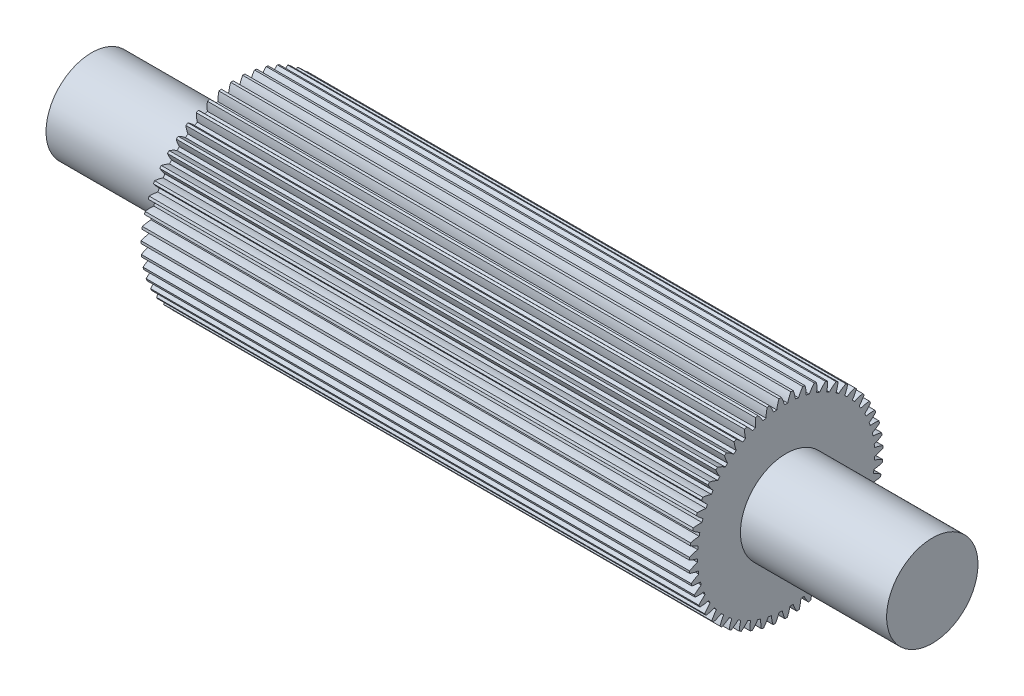
from build123d import *

# Parameters (mm, degrees)
BASPROSKE_W     = 80
BASPROSKE_H     = 53
TOOTHCUT_DEPTH  = 110.626639098
TEETHCUTS_COUNT = 51
TEETHCUTS_ANGLE = 352.941176471
BORSKE_R        = 0.4
BORE_DEPTH      = 80.0000508
SKETCH_2_R      = 25
EXTRUDE_1_DEPTH = 100
EXTRUDE_START   = -180
SKETCH_2_2_R    = 25
EXTRUDE_2_DEPTH = 100
EXTRUDE_3_DEPTH = 110
EXTRUDE_4_DEPTH = 110
SKETCH_5_R      = 25
EXTRUDE_5_DEPTH = 80
EXTRUDE_START_2 = -380
SKETCH_5_2_R    = 25
EXTRUDE_6_DEPTH = 80


with BuildPart() as part:
    # BasProSke → Base-Revolve (revolve)
    with BuildSketch(Plane(origin=(0, 0, 0), x_dir=(1, 0, 0), z_dir=(0, 1, 0)), mode=Mode.PRIVATE) as base_revolve_sk:
        with Locations((40, 26.5)):
            Rectangle(BASPROSKE_W, BASPROSKE_H)
    revolve(base_revolve_sk.sketch.rotate(Axis((-10, 0, 0), (1, 0, 0)), 180), axis=Axis((-10, 0, 0), (1, 0, 0)))

    # TooCutSke → ToothCut (cut, through all)
    with BuildSketch(Plane(origin=(0, 0, 0), x_dir=(0, 0, -1), z_dir=(1, 0, 0))):
        with BuildLine():
            ThreePointArc((0.858856185, 48.491394773), (0, 48.499), (-0.858856185, 48.491394773))
            ThreePointArc((-0.858856185, 48.491394773), (-1.609966515, 50.778076129), (-2.625171834, 52.960376868))
            ThreePointArc((-2.625171834, 52.960376868), (0, 53.0254), (2.625171834, 52.960376868))
            ThreePointArc((2.625171834, 52.960376868), (1.609966515, 50.778076129), (0.858856185, 48.491394773))
        make_face()
    toothcut = extrude(amount=TOOTHCUT_DEPTH, mode=Mode.SUBTRACT)

    # TeethCuts: ToothCut ×51 about axis
    teethcuts_axis = Axis((-10, 0, 0), (1, 0, 0))
    for i in range(1, TEETHCUTS_COUNT):
        add(toothcut.rotate(teethcuts_axis, i * TEETHCUTS_ANGLE / (TEETHCUTS_COUNT - 1)), mode=Mode.SUBTRACT)

    # BorSke → Bore (cut, symmetric)
    with BuildSketch(Plane(origin=(0, 0, 0), x_dir=(0, 0, -1), z_dir=(1, 0, 0))):
        with Locations(Location((0, 0, 0), (0, 0, 180))):
            Circle(BORSKE_R)
    extrude(amount=BORE_DEPTH, both=True, mode=Mode.SUBTRACT)

    # 草圖2 → 填料-伸長1 (add)
    with BuildSketch(Plane(origin=(80, 0, 0), x_dir=(0, 0, -1), z_dir=(1, 0, 0))):
        with Locations(Location((0.4, 0, 0), (0, 0, 180))):
            Circle(SKETCH_2_R)
    extrude(amount=EXTRUDE_1_DEPTH)

    # 草圖2<2> → 填料-伸長2 (add)
    with BuildSketch(Plane(origin=(80, 0, 0), x_dir=(0, 0, -1), z_dir=(1, 0, 0)).offset(EXTRUDE_START)):
        with Locations(Location((0.4, 0, 0), (0, 0, 180))):
            Circle(SKETCH_2_2_R)
    extrude(amount=EXTRUDE_2_DEPTH)

    # 草圖3 → 填料-伸長3 (add)
    with BuildSketch(Plane.ZY):
        with BuildLine():
            ThreePointArc((48.494844787, -0.634846495), (50.790336217, 0.040728753), (52.990930612, 0.980445269))
            ThreePointArc((52.990930612, 0.980445269), (52.974863145, 1.632138103), (52.950781335, 2.283584019))
            ThreePointArc((52.950781335, 2.283584019), (50.696510945, 3.086047617), (48.363784283, 3.619028988))
            ThreePointArc((48.363784283, 3.619028988), (48.292111816, 4.474923166), (48.205293781, 5.329413899))
            ThreePointArc((48.205293781, 5.329413899), (50.400366268, 6.28195765), (52.468801122, 7.484978877))
            ThreePointArc((52.468801122, 7.484978877), (52.37277002, 8.129757709), (52.268815664, 8.773306623))
            ThreePointArc((52.268815664, 8.773306623), (49.933018114, 9.292664521), (47.552475162, 9.534941374))
            ThreePointArc((47.552475162, 9.534941374), (47.376166563, 10.375540602), (47.184999658, 11.212885812))
            ThreePointArc((47.184999658, 11.212885812), (49.246378142, 12.427958472), (51.151298092, 13.876047835))
            ThreePointArc((51.151298092, 13.876047835), (50.976759088, 14.504138474), (50.794508027, 15.130034843))
            ThreePointArc((50.794508027, 15.130034843), (48.412591627, 15.358414104), (46.020318989, 15.306313767))
            ThreePointArc((46.020318989, 15.306313767), (45.742046917, 16.11887542), (45.449429039, 16.926381806))
            ThreePointArc((45.449429039, 16.926381806), (47.345865122, 18.385564112), (49.058393523, 20.056770053))
            ThreePointArc((49.058393523, 20.056770053), (48.807992451, 20.658651285), (48.550207425, 21.257407157))
            ThreePointArc((48.550207425, 21.257407157), (46.158279601, 21.191345785), (43.790541691, 20.845658046))
            ThreePointArc((43.790541691, 20.845658046), (43.414524467, 21.617864517), (43.024891404, 22.383291105))
            ThreePointArc((43.024891404, 22.383291105), (44.727637048, 24.064463342), (46.221813716, 25.933452081))
            ThreePointArc((46.221813716, 25.933452081), (45.899346401, 26.5), (45.569935168, 27.062538846))
            ThreePointArc((45.569935168, 27.062538846), (43.204255107, 26.703038264), (40.896944419, 26.069003399))
            ThreePointArc((40.896944419, 26.069003399), (40.428882081, 26.789148824), (39.948140272, 27.500892527))
            ThreePointArc((39.948140272, 27.500892527), (41.43138359, 29.378569837), (42.684558328, 31.417009411))
            ThreePointArc((42.684558328, 31.417009411), (42.294913046, 31.939635728), (41.898869145, 32.457430033))
            ThreePointArc((41.898869145, 32.457430033), (39.595298145, 31.809939904), (37.383391157, 30.897169233))
            ThreePointArc((37.383391157, 30.897169233), (36.830379053, 31.554336942), (36.265816055, 32.201608451))
            ThreePointArc((36.265816055, 32.201608451), (37.50707259, 34.24732716), (38.500248547, 36.424316902))
            ThreePointArc((38.500248547, 36.424316902), (38.049331922, 36.895099136), (37.592658975, 37.360299666))
            ThreePointArc((37.592658975, 37.360299666), (35.386116825, 36.434635279), (33.303143792, 35.256965476))
            ThreePointArc((33.303143792, 35.256965476), (32.673565021, 35.841193476), (32.033739034, 36.414180816))
            ThreePointArc((32.033739034, 36.414180816), (33.014192601, 38.596929914), (33.732314243, 40.879468879))
            ThreePointArc((33.732314243, 40.879468879), (33.226961712, 41.29127045), (32.716582415, 41.696825239))
            ThreePointArc((32.716582415, 41.696825239), (30.640518044, 40.507018723), (28.718054715, 39.082302061))
            ThreePointArc((28.718054715, 39.082302061), (28.021453049, 39.584734052), (27.316063182, 40.074751318))
            ThreePointArc((27.316063182, 40.074751318), (28.020851106, 42.361442553), (28.45303244, 44.714929777))
            ThreePointArc((28.45303244, 44.714929777), (27.900904632, 45.061508194), (27.344555816, 45.401269445))
            ThreePointArc((27.344555816, 45.401269445), (25.430440243, 43.965357054), (23.697629201, 42.315190786))
            ThreePointArc((23.697629201, 42.315190786), (22.944564413, 42.728210411), (22.184303657, 43.12782944))
            ThreePointArc((22.184303657, 43.12782944), (22.60274207, 45.483798904), (22.742431668, 47.87255792))
            ThreePointArc((22.742431668, 47.87255792), (22.151898279, 48.148659406), (21.558013623, 48.417476686))
            ThreePointArc((21.558013623, 48.417476686), (19.83486289, 46.757225388), (18.317971785, 44.906624352))
            ThreePointArc((18.317971785, 44.906624352), (17.519859568, 45.223970654), (16.716252702, 45.52713363))
            ThreePointArc((16.716252702, 45.52713363), (16.841998505, 47.916667228), (16.687078814, 50.304486884))
            ThreePointArc((16.687078814, 50.304486884), (16.067091728, 50.505926023), (15.444673919, 50.699724334))
            ThreePointArc((15.444673919, 50.699724334), (13.938609235, 48.840301847), (12.660632589, 46.817319268))
            ThreePointArc((12.660632589, 46.817319268), (11.829571512, 47.034181601), (10.994800396, 47.236292882))
            ThreePointArc((10.994800396, 47.236292882), (10.82594741, 49.62316772), (10.378766856, 51.973851104))
            ThreePointArc((10.378766856, 51.973851104), (9.738724444, 52.097574283), (9.097208702, 52.213415841))
            ThreePointArc((9.097208702, 52.213415841), (7.831060471, 50.183009114), (6.811371108, 48.018311347))
            ThreePointArc((6.811371108, 48.018311347), (5.959959209, 48.131402299), (5.106678123, 48.229398084))
            ThreePointArc((5.106678123, 48.229398084), (4.645785988, 50.577431572), (3.913123372, 52.85534472))
            ThreePointArc((3.913123372, 52.85534472), (3.262728025, 52.899476423), (2.611839074, 52.935605188))
            ThreePointArc((2.611839074, 52.935605188), (1.604800814, 50.764993117), (0.858856185, 48.491394773))
            ThreePointArc((0.858856185, 48.491394773), (0, 48.499), (-0.858856185, 48.491394773))
            ThreePointArc((-0.858856185, 48.491394773), (-1.604800814, 50.764993117), (-2.611839074, 52.935605188))
            ThreePointArc((-2.611839074, 52.935605188), (-3.262728025, 52.899476423), (-3.913123372, 52.85534472))
            ThreePointArc((-3.913123372, 52.85534472), (-4.645785988, 50.577431572), (-5.106678123, 48.229398084))
            ThreePointArc((-5.106678123, 48.229398084), (-5.959959209, 48.131402299), (-6.811371108, 48.018311347))
            ThreePointArc((-6.811371108, 48.018311347), (-7.831060471, 50.183009114), (-9.097208702, 52.213415841))
            ThreePointArc((-9.097208702, 52.213415841), (-9.738724444, 52.097574283), (-10.378766856, 51.973851104))
            ThreePointArc((-10.378766856, 51.973851104), (-10.82594741, 49.62316772), (-10.994800396, 47.236292882))
            ThreePointArc((-10.994800396, 47.236292882), (-11.829571512, 47.034181601), (-12.660632589, 46.817319268))
            ThreePointArc((-12.660632589, 46.817319268), (-13.938609235, 48.840301847), (-15.444673919, 50.699724334))
            ThreePointArc((-15.444673919, 50.699724334), (-16.067091728, 50.505926023), (-16.687078814, 50.304486884))
            ThreePointArc((-16.687078814, 50.304486884), (-16.841998505, 47.916667228), (-16.716252702, 45.52713363))
            ThreePointArc((-16.716252702, 45.52713363), (-17.519859568, 45.223970654), (-18.317971785, 44.906624352))
            ThreePointArc((-18.317971785, 44.906624352), (-19.83486289, 46.757225388), (-21.558013623, 48.417476686))
            ThreePointArc((-21.558013623, 48.417476686), (-22.151898279, 48.148659406), (-22.742431668, 47.87255792))
            ThreePointArc((-22.742431668, 47.87255792), (-22.60274207, 45.483798904), (-22.184303657, 43.12782944))
            ThreePointArc((-22.184303657, 43.12782944), (-22.944564413, 42.728210411), (-23.697629201, 42.315190786))
            ThreePointArc((-23.697629201, 42.315190786), (-25.430440243, 43.965357054), (-27.344555816, 45.401269445))
            ThreePointArc((-27.344555816, 45.401269445), (-27.900904632, 45.061508194), (-28.45303244, 44.714929777))
            ThreePointArc((-28.45303244, 44.714929777), (-28.020851106, 42.361442553), (-27.316063182, 40.074751318))
            ThreePointArc((-27.316063182, 40.074751318), (-28.021453049, 39.584734052), (-28.718054715, 39.082302061))
            ThreePointArc((-28.718054715, 39.082302061), (-30.640518044, 40.507018723), (-32.716582415, 41.696825239))
            ThreePointArc((-32.716582415, 41.696825239), (-33.226961712, 41.29127045), (-33.732314243, 40.879468879))
            ThreePointArc((-33.732314243, 40.879468879), (-33.014192601, 38.596929914), (-32.033739034, 36.414180816))
            ThreePointArc((-32.033739034, 36.414180816), (-32.673565021, 35.841193476), (-33.303143792, 35.256965476))
            ThreePointArc((-33.303143792, 35.256965476), (-35.386116825, 36.434635279), (-37.592658975, 37.360299666))
            ThreePointArc((-37.592658975, 37.360299666), (-38.049331922, 36.895099136), (-38.500248547, 36.424316902))
            ThreePointArc((-38.500248547, 36.424316902), (-37.50707259, 34.24732716), (-36.265816055, 32.201608451))
            ThreePointArc((-36.265816055, 32.201608451), (-36.830379053, 31.554336942), (-37.383391157, 30.897169233))
            ThreePointArc((-37.383391157, 30.897169233), (-39.595298145, 31.809939904), (-41.898869145, 32.457430033))
            ThreePointArc((-41.898869145, 32.457430033), (-42.294913046, 31.939635728), (-42.684558328, 31.417009411))
            ThreePointArc((-42.684558328, 31.417009411), (-41.43138359, 29.378569837), (-39.948140272, 27.500892527))
            ThreePointArc((-39.948140272, 27.500892527), (-40.428882081, 26.789148824), (-40.896944419, 26.069003399))
            ThreePointArc((-40.896944419, 26.069003399), (-43.204255107, 26.703038264), (-45.569935168, 27.062538846))
            ThreePointArc((-45.569935168, 27.062538846), (-45.899346401, 26.5), (-46.221813716, 25.933452081))
            ThreePointArc((-46.221813716, 25.933452081), (-44.727637048, 24.064463342), (-43.024891404, 22.383291105))
            ThreePointArc((-43.024891404, 22.383291105), (-43.414524467, 21.617864517), (-43.790541691, 20.845658046))
            ThreePointArc((-43.790541691, 20.845658046), (-46.158279601, 21.191345785), (-48.550207425, 21.257407157))
            ThreePointArc((-48.550207425, 21.257407157), (-48.807992451, 20.658651285), (-49.058393523, 20.056770053))
            ThreePointArc((-49.058393523, 20.056770053), (-47.345865122, 18.385564112), (-45.449429039, 16.926381806))
            ThreePointArc((-45.449429039, 16.926381806), (-45.742046917, 16.11887542), (-46.020318989, 15.306313767))
            ThreePointArc((-46.020318989, 15.306313767), (-48.412591627, 15.358414104), (-50.794508027, 15.130034843))
            ThreePointArc((-50.794508027, 15.130034843), (-50.976759088, 14.504138474), (-51.151298092, 13.876047835))
            ThreePointArc((-51.151298092, 13.876047835), (-49.246378142, 12.427958472), (-47.184999658, 11.212885812))
            ThreePointArc((-47.184999658, 11.212885812), (-47.376166563, 10.375540602), (-47.552475162, 9.534941374))
            ThreePointArc((-47.552475162, 9.534941374), (-49.933018114, 9.292664521), (-52.268815664, 8.773306623))
            ThreePointArc((-52.268815664, 8.773306623), (-52.37277002, 8.129757709), (-52.468801122, 7.484978877))
            ThreePointArc((-52.468801122, 7.484978877), (-50.400366268, 6.28195765), (-48.205293781, 5.329413899))
            ThreePointArc((-48.205293781, 5.329413899), (-48.292111816, 4.474923166), (-48.363784283, 3.619028988))
            ThreePointArc((-48.363784283, 3.619028988), (-50.696510945, 3.086047617), (-52.950781335, 2.283584019))
            ThreePointArc((-52.950781335, 2.283584019), (-52.974863145, 1.632138103), (-52.990930612, 0.980445269))
            ThreePointArc((-52.990930612, 0.980445269), (-50.790336217, 0.040728753), (-48.494844787, -0.634846495))
            ThreePointArc((-48.494844787, -0.634846495), (-48.47599788, -1.493529545), (-48.441947734, -2.351744188))
            ThreePointArc((-48.441947734, -2.351744188), (-50.691496347, -3.167350624), (-52.830067137, -4.240755392))
            ThreePointArc((-52.830067137, -4.240755392), (-52.773911344, -4.890223052), (-52.709771609, -5.53895089))
            ThreePointArc((-52.709771609, -5.53895089), (-50.410376442, -6.20111755), (-48.049263379, -6.589483264))
            ThreePointArc((-48.049263379, -6.589483264), (-47.92503723, -7.43934187), (-47.785780637, -8.286867319))
            ThreePointArc((-47.785780637, -8.286867319), (-49.918050336, -9.372735058), (-51.908502973, -10.700809274))
            ThreePointArc((-51.908502973, -10.700809274), (-51.772960841, -11.33845341), (-51.629586198, -11.9743822))
            ThreePointArc((-51.629586198, -11.9743822), (-49.266246745, -12.348961233), (-46.875304118, -12.444230184))
            ThreePointArc((-46.875304118, -12.444230184), (-46.647581868, -13.272381356), (-46.405229815, -14.096369989))
            ThreePointArc((-46.405229815, -14.096369989), (-48.387897567, -15.436038382), (-50.200058816, -16.998649795))
            ThreePointArc((-50.200058816, -16.998649795), (-49.987185027, -17.614804372), (-49.766748888, -18.228294081))
            ThreePointArc((-49.766748888, -18.228294081), (-47.375290967, -18.30960725), (-44.990763028, -18.110335259))
            ThreePointArc((-44.990763028, -18.110335259), (-44.662996715, -18.904225069), (-44.321223012, -19.692186058))
            ThreePointArc((-44.321223012, -19.692186058), (-46.124233594, -21.2653471), (-47.730632939, -23.038808112))
            ThreePointArc((-47.730632939, -23.038808112), (-47.443654442, -23.624132856), (-47.149498395, -24.205883605))
            ThreePointArc((-47.149498395, -24.205883605), (-44.76617407, -23.992698286), (-42.424207831, -23.501906112))
            ThreePointArc((-42.424207831, -23.501906112), (-42.001366058, -24.2495), (-41.565351646, -24.989488661))
            ThreePointArc((-41.565351646, -24.989488661), (-43.161373256, -26.772294832), (-44.537659321, -28.729721583))
            ThreePointArc((-44.537659321, -28.729721583), (-44.180926417, -29.275343567), (-43.817509568, -29.816536608))
            ThreePointArc((-43.817509568, -29.816536608), (-41.478447605, -29.312084472), (-39.214544888, -28.537212026))
            ThreePointArc((-39.214544888, -28.537212026), (-38.703037506, -29.22717723), (-38.179391919, -29.907976088))
            ThreePointArc((-38.179391919, -29.907976088), (-39.544230495, -31.873401864), (-40.669540186, -33.98512176))
            ThreePointArc((-40.669540186, -33.98512176), (-40.248460583, -34.482769911), (-39.82129196, -34.975201309))
            ThreePointArc((-39.82129196, -34.975201309), (-37.561950156, -34.187129337), (-35.410429419, -33.139922894))
            ThreePointArc((-35.410429419, -33.139922894), (-34.818010357, -33.761800245), (-34.214671529, -34.373089084))
            ThreePointArc((-34.214671529, -34.373089084), (-35.32763751, -36.491340614), (-36.184912278, -38.725342134))
            ThreePointArc((-36.184912278, -38.725342134), (-35.705869113, -39.167472613), (-35.221424158, -39.60367761))
            ThreePointArc((-35.221424158, -39.60367761), (-33.076051831, -38.54393217), (-31.069527934, -37.240266311))
            ThreePointArc((-31.069527934, -37.240266311), (-30.405177662, -37.784628784), (-29.731291595, -38.317141088))
            ThreePointArc((-29.731291595, -38.317141088), (-30.575513551, -40.556107838), (-31.151757985, -42.878525796))
            ThreePointArc((-31.151757985, -42.878525796), (-30.622013065, -43.258436355), (-30.087635469, -43.631802528))
            ThreePointArc((-30.087635469, -43.631802528), (-28.088754277, -42.31644828), (-26.257644077, -40.776085253))
            ThreePointArc((-26.257644077, -40.776085253), (-25.531433467, -41.234680866), (-24.797215586, -41.680344291))
            ThreePointArc((-24.797215586, -41.680344291), (-25.359895974, -44.006085807), (-25.646374796, -46.381714714))
            ThreePointArc((-25.646374796, -46.381714714), (-25.073958512, -46.693646297), (-24.497748896, -46.998513796))
            ThreePointArc((-24.497748896, -46.998513796), (-22.675659839, -45.44749017), (-21.047721101, -43.693780306))
            ThreePointArc((-21.047721101, -43.693780306), (-20.270658767, -44.059657218), (-19.487239066, -44.411715961))
            ThreePointArc((-19.487239066, -44.411715961), (-19.759848224, -46.788976373), (-19.752218707, -49.181804117))
            ThreePointArc((-19.752218707, -49.181804117), (-19.145808308, -49.421028158), (-18.536501421, -49.652775502))
            ThreePointArc((-18.536501421, -49.652775502), (-16.918825513, -47.889594435), (-15.518736128, -45.94912219))
            ThreePointArc((-15.518736128, -45.94912219), (-14.702601542, -46.216734079), (-13.881855866, -46.469851288))
            ThreePointArc((-13.881855866, -46.469851288), (-13.860261317, -48.862593751), (-13.558639116, -51.236347502))
            ThreePointArc((-13.558639116, -51.236347502), (-12.927427166, -51.39923761), (-12.294259479, -51.554351745))
            ThreePointArc((-12.294259479, -51.554351745), (-10.905519038, -49.605741264), (-9.754502934, -47.507922218))
            ThreePointArc((-9.754502934, -47.507922218), (-8.911667865, -47.673212362), (-8.066037882, -47.823551038))
            ThreePointArc((-8.066037882, -47.823551038), (-7.750566977, -50.195504016), (-7.159524378, -52.514200086))
            ThreePointArc((-7.159524378, -52.514200086), (-6.513079405, -52.598287013), (-5.865649096, -52.674416567))
            ThreePointArc((-5.865649096, -52.674416567), (-4.72689601, -50.569915621), (-3.842401419, -48.346550573))
            ThreePointArc((-3.842401419, -48.346550573), (-2.985642387, -48.40701334), (-2.127946985, -48.452294503))
            ThreePointArc((-2.127946985, -48.452294503), (-1.523381942, -50.767501606), (-0.651878548, -52.995990927))
            ThreePointArc((-0.651878548, -52.995990927), (0, -53), (0.651878548, -52.995990927))
            ThreePointArc((0.651878548, -52.995990927), (1.523381942, -50.767501606), (2.127946985, -48.452294503))
            ThreePointArc((2.127946985, -48.452294503), (2.985642387, -48.40701334), (3.842401419, -48.346550573))
            ThreePointArc((3.842401419, -48.346550573), (4.72689601, -50.569915621), (5.865649096, -52.674416567))
            ThreePointArc((5.865649096, -52.674416567), (6.513079405, -52.598287013), (7.159524378, -52.514200086))
            ThreePointArc((7.159524378, -52.514200086), (7.750566977, -50.195504016), (8.066037882, -47.823551038))
            ThreePointArc((8.066037882, -47.823551038), (8.911667865, -47.673212362), (9.754502934, -47.507922218))
            ThreePointArc((9.754502934, -47.507922218), (10.905519038, -49.605741264), (12.294259479, -51.554351745))
            ThreePointArc((12.294259479, -51.554351745), (12.927427166, -51.39923761), (13.558639116, -51.236347502))
            ThreePointArc((13.558639116, -51.236347502), (13.860261317, -48.862593751), (13.881855866, -46.469851288))
            ThreePointArc((13.881855866, -46.469851288), (14.702601542, -46.216734079), (15.518736128, -45.94912219))
            ThreePointArc((15.518736128, -45.94912219), (16.918825513, -47.889594435), (18.536501421, -49.652775502))
            ThreePointArc((18.536501421, -49.652775502), (19.145808308, -49.421028158), (19.752218707, -49.181804117))
            ThreePointArc((19.752218707, -49.181804117), (19.759848224, -46.788976373), (19.487239066, -44.411715961))
            ThreePointArc((19.487239066, -44.411715961), (20.270658767, -44.059657218), (21.047721101, -43.693780306))
            ThreePointArc((21.047721101, -43.693780306), (22.675659839, -45.44749017), (24.497748896, -46.998513796))
            ThreePointArc((24.497748896, -46.998513796), (25.073958512, -46.693646297), (25.646374796, -46.381714714))
            ThreePointArc((25.646374796, -46.381714714), (25.359895974, -44.006085807), (24.797215586, -41.680344291))
            ThreePointArc((24.797215586, -41.680344291), (25.531433467, -41.234680866), (26.257644077, -40.776085253))
            ThreePointArc((26.257644077, -40.776085253), (28.088754277, -42.31644828), (30.087635469, -43.631802528))
            ThreePointArc((30.087635469, -43.631802528), (30.622013065, -43.258436355), (31.151757985, -42.878525796))
            ThreePointArc((31.151757985, -42.878525796), (30.575513551, -40.556107838), (29.731291595, -38.317141088))
            ThreePointArc((29.731291595, -38.317141088), (30.405177662, -37.784628784), (31.069527934, -37.240266311))
            ThreePointArc((31.069527934, -37.240266311), (33.076051831, -38.54393217), (35.221424158, -39.60367761))
            ThreePointArc((35.221424158, -39.60367761), (35.705869113, -39.167472613), (36.184912278, -38.725342134))
            ThreePointArc((36.184912278, -38.725342134), (35.32763751, -36.491340614), (34.214671529, -34.373089084))
            ThreePointArc((34.214671529, -34.373089084), (34.818010357, -33.761800245), (35.410429419, -33.139922894))
            ThreePointArc((35.410429419, -33.139922894), (37.561950156, -34.187129337), (39.82129196, -34.975201309))
            ThreePointArc((39.82129196, -34.975201309), (40.248460583, -34.482769911), (40.669540186, -33.98512176))
            ThreePointArc((40.669540186, -33.98512176), (39.544230495, -31.873401864), (38.179391919, -29.907976088))
            ThreePointArc((38.179391919, -29.907976088), (38.703037506, -29.22717723), (39.214544888, -28.537212026))
            ThreePointArc((39.214544888, -28.537212026), (41.478447605, -29.312084472), (43.817509568, -29.816536608))
            ThreePointArc((43.817509568, -29.816536608), (44.180926417, -29.275343567), (44.537659321, -28.729721583))
            ThreePointArc((44.537659321, -28.729721583), (43.161373256, -26.772294832), (41.565351646, -24.989488661))
            ThreePointArc((41.565351646, -24.989488661), (42.001366058, -24.2495), (42.424207831, -23.501906112))
            ThreePointArc((42.424207831, -23.501906112), (44.76617407, -23.992698286), (47.149498395, -24.205883605))
            ThreePointArc((47.149498395, -24.205883605), (47.443654442, -23.624132856), (47.730632939, -23.038808112))
            ThreePointArc((47.730632939, -23.038808112), (46.124233594, -21.2653471), (44.321223012, -19.692186058))
            ThreePointArc((44.321223012, -19.692186058), (44.662996715, -18.904225069), (44.990763028, -18.110335259))
            ThreePointArc((44.990763028, -18.110335259), (47.375290967, -18.30960725), (49.766748888, -18.228294081))
            ThreePointArc((49.766748888, -18.228294081), (49.987185027, -17.614804372), (50.200058816, -16.998649795))
            ThreePointArc((50.200058816, -16.998649795), (48.387897567, -15.436038382), (46.405229815, -14.096369989))
            ThreePointArc((46.405229815, -14.096369989), (46.647581868, -13.272381356), (46.875304118, -12.444230184))
            ThreePointArc((46.875304118, -12.444230184), (49.266246745, -12.348961233), (51.629586198, -11.9743822))
            ThreePointArc((51.629586198, -11.9743822), (51.772960841, -11.33845341), (51.908502973, -10.700809274))
            ThreePointArc((51.908502973, -10.700809274), (49.918050336, -9.372735058), (47.785780637, -8.286867319))
            ThreePointArc((47.785780637, -8.286867319), (47.92503723, -7.43934187), (48.049263379, -6.589483264))
            ThreePointArc((48.049263379, -6.589483264), (50.410376442, -6.20111755), (52.709771609, -5.53895089))
            ThreePointArc((52.709771609, -5.53895089), (52.773911344, -4.890223052), (52.830067137, -4.240755392))
            ThreePointArc((52.830067137, -4.240755392), (50.691496347, -3.167350624), (48.441947734, -2.351744188))
            ThreePointArc((48.441947734, -2.351744188), (48.47599788, -1.493529545), (48.494844787, -0.634846495))
        make_face()
    extrude(amount=EXTRUDE_3_DEPTH)

    # 草圖4 → 填料-伸長4 (add)
    with BuildSketch(Plane(origin=(80, 0, 0), x_dir=(0, 0, -1), z_dir=(1, 0, 0))):
        with BuildLine():
            ThreePointArc((-52.990930612, 0.980445269), (-50.790336217, 0.040728753), (-48.494844787, -0.634846495))
            ThreePointArc((-48.494844787, -0.634846495), (-48.47599788, -1.493529545), (-48.441947734, -2.351744188))
            ThreePointArc((-48.441947734, -2.351744188), (-50.691496347, -3.167350624), (-52.830067137, -4.240755392))
            ThreePointArc((-52.830067137, -4.240755392), (-52.773911344, -4.890223052), (-52.709771609, -5.53895089))
            ThreePointArc((-52.709771609, -5.53895089), (-50.410376442, -6.20111755), (-48.049263379, -6.589483264))
            ThreePointArc((-48.049263379, -6.589483264), (-47.92503723, -7.43934187), (-47.785780637, -8.286867319))
            ThreePointArc((-47.785780637, -8.286867319), (-49.918050336, -9.372735058), (-51.908502973, -10.700809274))
            ThreePointArc((-51.908502973, -10.700809274), (-51.772960841, -11.33845341), (-51.629586198, -11.9743822))
            ThreePointArc((-51.629586198, -11.9743822), (-49.266246745, -12.348961233), (-46.875304118, -12.444230184))
            ThreePointArc((-46.875304118, -12.444230184), (-46.647581868, -13.272381356), (-46.405229815, -14.096369989))
            ThreePointArc((-46.405229815, -14.096369989), (-48.387897567, -15.436038382), (-50.200058816, -16.998649795))
            ThreePointArc((-50.200058816, -16.998649795), (-49.987185027, -17.614804372), (-49.766748888, -18.228294081))
            ThreePointArc((-49.766748888, -18.228294081), (-47.375290967, -18.30960725), (-44.990763028, -18.110335259))
            ThreePointArc((-44.990763028, -18.110335259), (-44.662996715, -18.904225069), (-44.321223012, -19.692186058))
            ThreePointArc((-44.321223012, -19.692186058), (-46.124233594, -21.2653471), (-47.730632939, -23.038808112))
            ThreePointArc((-47.730632939, -23.038808112), (-47.443654442, -23.624132856), (-47.149498395, -24.205883605))
            ThreePointArc((-47.149498395, -24.205883605), (-44.76617407, -23.992698286), (-42.424207831, -23.501906112))
            ThreePointArc((-42.424207831, -23.501906112), (-42.001366058, -24.2495), (-41.565351646, -24.989488661))
            ThreePointArc((-41.565351646, -24.989488661), (-43.161373256, -26.772294832), (-44.537659321, -28.729721583))
            ThreePointArc((-44.537659321, -28.729721583), (-44.180926417, -29.275343567), (-43.817509568, -29.816536608))
            ThreePointArc((-43.817509568, -29.816536608), (-41.478447605, -29.312084472), (-39.214544888, -28.537212026))
            ThreePointArc((-39.214544888, -28.537212026), (-38.703037506, -29.22717723), (-38.179391919, -29.907976088))
            ThreePointArc((-38.179391919, -29.907976088), (-39.544230495, -31.873401864), (-40.669540186, -33.98512176))
            ThreePointArc((-40.669540186, -33.98512176), (-40.248460583, -34.482769911), (-39.82129196, -34.975201309))
            ThreePointArc((-39.82129196, -34.975201309), (-37.561950156, -34.187129337), (-35.410429419, -33.139922894))
            ThreePointArc((-35.410429419, -33.139922894), (-34.818010357, -33.761800245), (-34.214671529, -34.373089084))
            ThreePointArc((-34.214671529, -34.373089084), (-35.32763751, -36.491340614), (-36.184912278, -38.725342134))
            ThreePointArc((-36.184912278, -38.725342134), (-35.705869113, -39.167472613), (-35.221424158, -39.60367761))
            ThreePointArc((-35.221424158, -39.60367761), (-33.076051831, -38.54393217), (-31.069527934, -37.240266311))
            ThreePointArc((-31.069527934, -37.240266311), (-30.405177662, -37.784628784), (-29.731291595, -38.317141088))
            ThreePointArc((-29.731291595, -38.317141088), (-30.575513551, -40.556107838), (-31.151757985, -42.878525796))
            ThreePointArc((-31.151757985, -42.878525796), (-30.622013065, -43.258436355), (-30.087635469, -43.631802528))
            ThreePointArc((-30.087635469, -43.631802528), (-28.088754277, -42.31644828), (-26.257644077, -40.776085253))
            ThreePointArc((-26.257644077, -40.776085253), (-25.531433467, -41.234680866), (-24.797215586, -41.680344291))
            ThreePointArc((-24.797215586, -41.680344291), (-25.359895974, -44.006085807), (-25.646374796, -46.381714714))
            ThreePointArc((-25.646374796, -46.381714714), (-25.073958512, -46.693646297), (-24.497748896, -46.998513796))
            ThreePointArc((-24.497748896, -46.998513796), (-22.675659839, -45.44749017), (-21.047721101, -43.693780306))
            ThreePointArc((-21.047721101, -43.693780306), (-20.270658767, -44.059657218), (-19.487239066, -44.411715961))
            ThreePointArc((-19.487239066, -44.411715961), (-19.759848224, -46.788976373), (-19.752218707, -49.181804117))
            ThreePointArc((-19.752218707, -49.181804117), (-19.145808308, -49.421028158), (-18.536501421, -49.652775502))
            ThreePointArc((-18.536501421, -49.652775502), (-16.918825513, -47.889594435), (-15.518736128, -45.94912219))
            ThreePointArc((-15.518736128, -45.94912219), (-14.702601542, -46.216734079), (-13.881855866, -46.469851288))
            ThreePointArc((-13.881855866, -46.469851288), (-13.860261317, -48.862593751), (-13.558639116, -51.236347502))
            ThreePointArc((-13.558639116, -51.236347502), (-12.927427166, -51.39923761), (-12.294259479, -51.554351745))
            ThreePointArc((-12.294259479, -51.554351745), (-10.905519038, -49.605741264), (-9.754502934, -47.507922218))
            ThreePointArc((-9.754502934, -47.507922218), (-8.911667865, -47.673212362), (-8.066037882, -47.823551038))
            ThreePointArc((-8.066037882, -47.823551038), (-7.750566977, -50.195504016), (-7.159524378, -52.514200086))
            ThreePointArc((-7.159524378, -52.514200086), (-6.513079405, -52.598287013), (-5.865649096, -52.674416567))
            ThreePointArc((-5.865649096, -52.674416567), (-4.72689601, -50.569915621), (-3.842401419, -48.346550573))
            ThreePointArc((-3.842401419, -48.346550573), (-2.985642387, -48.40701334), (-2.127946985, -48.452294503))
            ThreePointArc((-2.127946985, -48.452294503), (-1.523381942, -50.767501606), (-0.651878548, -52.995990927))
            ThreePointArc((-0.651878548, -52.995990927), (0, -53), (0.651878548, -52.995990927))
            ThreePointArc((0.651878548, -52.995990927), (1.523381942, -50.767501606), (2.127946985, -48.452294503))
            ThreePointArc((2.127946985, -48.452294503), (2.985642387, -48.40701334), (3.842401419, -48.346550573))
            ThreePointArc((3.842401419, -48.346550573), (4.72689601, -50.569915621), (5.865649096, -52.674416567))
            ThreePointArc((5.865649096, -52.674416567), (6.513079405, -52.598287013), (7.159524378, -52.514200086))
            ThreePointArc((7.159524378, -52.514200086), (7.750566977, -50.195504016), (8.066037882, -47.823551038))
            ThreePointArc((8.066037882, -47.823551038), (8.911667865, -47.673212362), (9.754502934, -47.507922218))
            ThreePointArc((9.754502934, -47.507922218), (10.905519038, -49.605741264), (12.294259479, -51.554351745))
            ThreePointArc((12.294259479, -51.554351745), (12.927427166, -51.39923761), (13.558639116, -51.236347502))
            ThreePointArc((13.558639116, -51.236347502), (13.860261317, -48.862593751), (13.881855866, -46.469851288))
            ThreePointArc((13.881855866, -46.469851288), (14.702601542, -46.216734079), (15.518736128, -45.94912219))
            ThreePointArc((15.518736128, -45.94912219), (16.918825513, -47.889594435), (18.536501421, -49.652775502))
            ThreePointArc((18.536501421, -49.652775502), (19.145808308, -49.421028158), (19.752218707, -49.181804117))
            ThreePointArc((19.752218707, -49.181804117), (19.759848224, -46.788976373), (19.487239066, -44.411715961))
            ThreePointArc((19.487239066, -44.411715961), (20.270658767, -44.059657218), (21.047721101, -43.693780306))
            ThreePointArc((21.047721101, -43.693780306), (22.675659839, -45.44749017), (24.497748896, -46.998513796))
            ThreePointArc((24.497748896, -46.998513796), (25.073958512, -46.693646297), (25.646374796, -46.381714714))
            ThreePointArc((25.646374796, -46.381714714), (25.359895974, -44.006085807), (24.797215586, -41.680344291))
            ThreePointArc((24.797215586, -41.680344291), (25.531433467, -41.234680866), (26.257644077, -40.776085253))
            ThreePointArc((26.257644077, -40.776085253), (28.088754277, -42.31644828), (30.087635469, -43.631802528))
            ThreePointArc((30.087635469, -43.631802528), (30.622013065, -43.258436355), (31.151757985, -42.878525796))
            ThreePointArc((31.151757985, -42.878525796), (30.575513551, -40.556107838), (29.731291595, -38.317141088))
            ThreePointArc((29.731291595, -38.317141088), (30.405177662, -37.784628784), (31.069527934, -37.240266311))
            ThreePointArc((31.069527934, -37.240266311), (33.076051831, -38.54393217), (35.221424158, -39.60367761))
            ThreePointArc((35.221424158, -39.60367761), (35.705869113, -39.167472613), (36.184912278, -38.725342134))
            ThreePointArc((36.184912278, -38.725342134), (35.32763751, -36.491340614), (34.214671529, -34.373089084))
            ThreePointArc((34.214671529, -34.373089084), (34.818010357, -33.761800245), (35.410429419, -33.139922894))
            ThreePointArc((35.410429419, -33.139922894), (37.561950156, -34.187129337), (39.82129196, -34.975201309))
            ThreePointArc((39.82129196, -34.975201309), (40.248460583, -34.482769911), (40.669540186, -33.98512176))
            ThreePointArc((40.669540186, -33.98512176), (39.544230495, -31.873401864), (38.179391919, -29.907976088))
            ThreePointArc((38.179391919, -29.907976088), (38.703037506, -29.22717723), (39.214544888, -28.537212026))
            ThreePointArc((39.214544888, -28.537212026), (41.478447605, -29.312084472), (43.817509568, -29.816536608))
            ThreePointArc((43.817509568, -29.816536608), (44.180926417, -29.275343567), (44.537659321, -28.729721583))
            ThreePointArc((44.537659321, -28.729721583), (43.161373256, -26.772294832), (41.565351646, -24.989488661))
            ThreePointArc((41.565351646, -24.989488661), (42.001366058, -24.2495), (42.424207831, -23.501906112))
            ThreePointArc((42.424207831, -23.501906112), (44.76617407, -23.992698286), (47.149498395, -24.205883605))
            ThreePointArc((47.149498395, -24.205883605), (47.443654442, -23.624132856), (47.730632939, -23.038808112))
            ThreePointArc((47.730632939, -23.038808112), (46.124233594, -21.2653471), (44.321223012, -19.692186058))
            ThreePointArc((44.321223012, -19.692186058), (44.662996715, -18.904225069), (44.990763028, -18.110335259))
            ThreePointArc((44.990763028, -18.110335259), (47.375290967, -18.30960725), (49.766748888, -18.228294081))
            ThreePointArc((49.766748888, -18.228294081), (49.987185027, -17.614804372), (50.200058816, -16.998649795))
            ThreePointArc((50.200058816, -16.998649795), (48.387897567, -15.436038382), (46.405229815, -14.096369989))
            ThreePointArc((46.405229815, -14.096369989), (46.647581868, -13.272381356), (46.875304118, -12.444230184))
            ThreePointArc((46.875304118, -12.444230184), (49.266246745, -12.348961233), (51.629586198, -11.9743822))
            ThreePointArc((51.629586198, -11.9743822), (51.772960841, -11.33845341), (51.908502973, -10.700809274))
            ThreePointArc((51.908502973, -10.700809274), (49.918050336, -9.372735058), (47.785780637, -8.286867319))
            ThreePointArc((47.785780637, -8.286867319), (47.92503723, -7.43934187), (48.049263379, -6.589483264))
            ThreePointArc((48.049263379, -6.589483264), (50.410376442, -6.20111755), (52.709771609, -5.53895089))
            ThreePointArc((52.709771609, -5.53895089), (52.773911344, -4.890223052), (52.830067137, -4.240755392))
            ThreePointArc((52.830067137, -4.240755392), (50.691496347, -3.167350624), (48.441947734, -2.351744188))
            ThreePointArc((48.441947734, -2.351744188), (48.47599788, -1.493529545), (48.494844787, -0.634846495))
            ThreePointArc((48.494844787, -0.634846495), (50.790336217, 0.040728753), (52.990930612, 0.980445269))
            ThreePointArc((52.990930612, 0.980445269), (52.974863145, 1.632138103), (52.950781335, 2.283584019))
            ThreePointArc((52.950781335, 2.283584019), (50.696510945, 3.086047617), (48.363784283, 3.619028988))
            ThreePointArc((48.363784283, 3.619028988), (48.292111816, 4.474923166), (48.205293781, 5.329413899))
            ThreePointArc((48.205293781, 5.329413899), (50.400366268, 6.28195765), (52.468801122, 7.484978877))
            ThreePointArc((52.468801122, 7.484978877), (52.37277002, 8.129757709), (52.268815664, 8.773306623))
            ThreePointArc((52.268815664, 8.773306623), (49.933018114, 9.292664521), (47.552475162, 9.534941374))
            ThreePointArc((47.552475162, 9.534941374), (47.376166563, 10.375540602), (47.184999658, 11.212885812))
            ThreePointArc((47.184999658, 11.212885812), (49.246378142, 12.427958472), (51.151298092, 13.876047835))
            ThreePointArc((51.151298092, 13.876047835), (50.976759088, 14.504138474), (50.794508027, 15.130034843))
            ThreePointArc((50.794508027, 15.130034843), (48.412591627, 15.358414104), (46.020318989, 15.306313767))
            ThreePointArc((46.020318989, 15.306313767), (45.742046917, 16.11887542), (45.449429039, 16.926381806))
            ThreePointArc((45.449429039, 16.926381806), (47.345865122, 18.385564112), (49.058393523, 20.056770053))
            ThreePointArc((49.058393523, 20.056770053), (48.807992451, 20.658651285), (48.550207425, 21.257407157))
            ThreePointArc((48.550207425, 21.257407157), (46.158279601, 21.191345785), (43.790541691, 20.845658046))
            ThreePointArc((43.790541691, 20.845658046), (43.414524467, 21.617864517), (43.024891404, 22.383291105))
            ThreePointArc((43.024891404, 22.383291105), (44.727637048, 24.064463342), (46.221813716, 25.933452081))
            ThreePointArc((46.221813716, 25.933452081), (45.899346401, 26.5), (45.569935168, 27.062538846))
            ThreePointArc((45.569935168, 27.062538846), (43.204255107, 26.703038264), (40.896944419, 26.069003399))
            ThreePointArc((40.896944419, 26.069003399), (40.428882081, 26.789148824), (39.948140272, 27.500892527))
            ThreePointArc((39.948140272, 27.500892527), (41.43138359, 29.378569837), (42.684558328, 31.417009411))
            ThreePointArc((42.684558328, 31.417009411), (42.294913046, 31.939635728), (41.898869145, 32.457430033))
            ThreePointArc((41.898869145, 32.457430033), (39.595298145, 31.809939904), (37.383391157, 30.897169233))
            ThreePointArc((37.383391157, 30.897169233), (36.830379053, 31.554336942), (36.265816055, 32.201608451))
            ThreePointArc((36.265816055, 32.201608451), (37.50707259, 34.24732716), (38.500248547, 36.424316902))
            ThreePointArc((38.500248547, 36.424316902), (38.049331922, 36.895099136), (37.592658975, 37.360299666))
            ThreePointArc((37.592658975, 37.360299666), (35.386116825, 36.434635279), (33.303143792, 35.256965476))
            ThreePointArc((33.303143792, 35.256965476), (32.673565021, 35.841193476), (32.033739034, 36.414180816))
            ThreePointArc((32.033739034, 36.414180816), (33.014192601, 38.596929914), (33.732314243, 40.879468879))
            ThreePointArc((33.732314243, 40.879468879), (33.226961712, 41.29127045), (32.716582415, 41.696825239))
            ThreePointArc((32.716582415, 41.696825239), (30.640518044, 40.507018723), (28.718054715, 39.082302061))
            ThreePointArc((28.718054715, 39.082302061), (28.021453049, 39.584734052), (27.316063182, 40.074751318))
            ThreePointArc((27.316063182, 40.074751318), (28.020851106, 42.361442553), (28.45303244, 44.714929777))
            ThreePointArc((28.45303244, 44.714929777), (27.900904632, 45.061508194), (27.344555816, 45.401269445))
            ThreePointArc((27.344555816, 45.401269445), (25.430440243, 43.965357054), (23.697629201, 42.315190786))
            ThreePointArc((23.697629201, 42.315190786), (22.944564413, 42.728210411), (22.184303657, 43.12782944))
            ThreePointArc((22.184303657, 43.12782944), (22.60274207, 45.483798904), (22.742431668, 47.87255792))
            ThreePointArc((22.742431668, 47.87255792), (22.151898279, 48.148659406), (21.558013623, 48.417476686))
            ThreePointArc((21.558013623, 48.417476686), (19.83486289, 46.757225388), (18.317971785, 44.906624352))
            ThreePointArc((18.317971785, 44.906624352), (17.519859568, 45.223970654), (16.716252702, 45.52713363))
            ThreePointArc((16.716252702, 45.52713363), (16.841998505, 47.916667228), (16.687078814, 50.304486884))
            ThreePointArc((16.687078814, 50.304486884), (16.067091728, 50.505926023), (15.444673919, 50.699724334))
            ThreePointArc((15.444673919, 50.699724334), (13.938609235, 48.840301847), (12.660632589, 46.817319268))
            ThreePointArc((12.660632589, 46.817319268), (11.829571512, 47.034181601), (10.994800396, 47.236292882))
            ThreePointArc((10.994800396, 47.236292882), (10.82594741, 49.62316772), (10.378766856, 51.973851104))
            ThreePointArc((10.378766856, 51.973851104), (9.738724444, 52.097574283), (9.097208702, 52.213415841))
            ThreePointArc((9.097208702, 52.213415841), (7.831060471, 50.183009114), (6.811371108, 48.018311347))
            ThreePointArc((6.811371108, 48.018311347), (5.959959209, 48.131402299), (5.106678123, 48.229398084))
            ThreePointArc((5.106678123, 48.229398084), (4.645785988, 50.577431572), (3.913123372, 52.85534472))
            ThreePointArc((3.913123372, 52.85534472), (3.262728025, 52.899476423), (2.611839074, 52.935605188))
            ThreePointArc((2.611839074, 52.935605188), (1.604800814, 50.764993117), (0.858856185, 48.491394773))
            ThreePointArc((0.858856185, 48.491394773), (0, 48.499), (-0.858856185, 48.491394773))
            ThreePointArc((-0.858856185, 48.491394773), (-1.604800814, 50.764993117), (-2.611839074, 52.935605188))
            ThreePointArc((-2.611839074, 52.935605188), (-3.262728025, 52.899476423), (-3.913123372, 52.85534472))
            ThreePointArc((-3.913123372, 52.85534472), (-4.645785988, 50.577431572), (-5.106678123, 48.229398084))
            ThreePointArc((-5.106678123, 48.229398084), (-5.959959209, 48.131402299), (-6.811371108, 48.018311347))
            ThreePointArc((-6.811371108, 48.018311347), (-7.831060471, 50.183009114), (-9.097208702, 52.213415841))
            ThreePointArc((-9.097208702, 52.213415841), (-9.738724444, 52.097574283), (-10.378766856, 51.973851104))
            ThreePointArc((-10.378766856, 51.973851104), (-10.82594741, 49.62316772), (-10.994800396, 47.236292882))
            ThreePointArc((-10.994800396, 47.236292882), (-11.829571512, 47.034181601), (-12.660632589, 46.817319268))
            ThreePointArc((-12.660632589, 46.817319268), (-13.938609235, 48.840301847), (-15.444673919, 50.699724334))
            ThreePointArc((-15.444673919, 50.699724334), (-16.067091728, 50.505926023), (-16.687078814, 50.304486884))
            ThreePointArc((-16.687078814, 50.304486884), (-16.841998505, 47.916667228), (-16.716252702, 45.52713363))
            ThreePointArc((-16.716252702, 45.52713363), (-17.519859568, 45.223970654), (-18.317971785, 44.906624352))
            ThreePointArc((-18.317971785, 44.906624352), (-19.83486289, 46.757225388), (-21.558013623, 48.417476686))
            ThreePointArc((-21.558013623, 48.417476686), (-22.151898279, 48.148659406), (-22.742431668, 47.87255792))
            ThreePointArc((-22.742431668, 47.87255792), (-22.60274207, 45.483798904), (-22.184303657, 43.12782944))
            ThreePointArc((-22.184303657, 43.12782944), (-22.944564413, 42.728210411), (-23.697629201, 42.315190786))
            ThreePointArc((-23.697629201, 42.315190786), (-25.430440243, 43.965357054), (-27.344555816, 45.401269445))
            ThreePointArc((-27.344555816, 45.401269445), (-27.900904632, 45.061508194), (-28.45303244, 44.714929777))
            ThreePointArc((-28.45303244, 44.714929777), (-28.020851106, 42.361442553), (-27.316063182, 40.074751318))
            ThreePointArc((-27.316063182, 40.074751318), (-28.021453049, 39.584734052), (-28.718054715, 39.082302061))
            ThreePointArc((-28.718054715, 39.082302061), (-30.640518044, 40.507018723), (-32.716582415, 41.696825239))
            ThreePointArc((-32.716582415, 41.696825239), (-33.226961712, 41.29127045), (-33.732314243, 40.879468879))
            ThreePointArc((-33.732314243, 40.879468879), (-33.014192601, 38.596929914), (-32.033739034, 36.414180816))
            ThreePointArc((-32.033739034, 36.414180816), (-32.673565021, 35.841193476), (-33.303143792, 35.256965476))
            ThreePointArc((-33.303143792, 35.256965476), (-35.386116825, 36.434635279), (-37.592658975, 37.360299666))
            ThreePointArc((-37.592658975, 37.360299666), (-38.049331922, 36.895099136), (-38.500248547, 36.424316902))
            ThreePointArc((-38.500248547, 36.424316902), (-37.50707259, 34.24732716), (-36.265816055, 32.201608451))
            ThreePointArc((-36.265816055, 32.201608451), (-36.830379053, 31.554336942), (-37.383391157, 30.897169233))
            ThreePointArc((-37.383391157, 30.897169233), (-39.595298145, 31.809939904), (-41.898869145, 32.457430033))
            ThreePointArc((-41.898869145, 32.457430033), (-42.294913046, 31.939635728), (-42.684558328, 31.417009411))
            ThreePointArc((-42.684558328, 31.417009411), (-41.43138359, 29.378569837), (-39.948140272, 27.500892527))
            ThreePointArc((-39.948140272, 27.500892527), (-40.428882081, 26.789148824), (-40.896944419, 26.069003399))
            ThreePointArc((-40.896944419, 26.069003399), (-43.204255107, 26.703038264), (-45.569935168, 27.062538846))
            ThreePointArc((-45.569935168, 27.062538846), (-45.899346401, 26.5), (-46.221813716, 25.933452081))
            ThreePointArc((-46.221813716, 25.933452081), (-44.727637048, 24.064463342), (-43.024891404, 22.383291105))
            ThreePointArc((-43.024891404, 22.383291105), (-43.414524467, 21.617864517), (-43.790541691, 20.845658046))
            ThreePointArc((-43.790541691, 20.845658046), (-46.158279601, 21.191345785), (-48.550207425, 21.257407157))
            ThreePointArc((-48.550207425, 21.257407157), (-48.807992451, 20.658651285), (-49.058393523, 20.056770053))
            ThreePointArc((-49.058393523, 20.056770053), (-47.345865122, 18.385564112), (-45.449429039, 16.926381806))
            ThreePointArc((-45.449429039, 16.926381806), (-45.742046917, 16.11887542), (-46.020318989, 15.306313767))
            ThreePointArc((-46.020318989, 15.306313767), (-48.412591627, 15.358414104), (-50.794508027, 15.130034843))
            ThreePointArc((-50.794508027, 15.130034843), (-50.976759088, 14.504138474), (-51.151298092, 13.876047835))
            ThreePointArc((-51.151298092, 13.876047835), (-49.246378142, 12.427958472), (-47.184999658, 11.212885812))
            ThreePointArc((-47.184999658, 11.212885812), (-47.376166563, 10.375540602), (-47.552475162, 9.534941374))
            ThreePointArc((-47.552475162, 9.534941374), (-49.933018114, 9.292664521), (-52.268815664, 8.773306623))
            ThreePointArc((-52.268815664, 8.773306623), (-52.37277002, 8.129757709), (-52.468801122, 7.484978877))
            ThreePointArc((-52.468801122, 7.484978877), (-50.400366268, 6.28195765), (-48.205293781, 5.329413899))
            ThreePointArc((-48.205293781, 5.329413899), (-48.292111816, 4.474923166), (-48.363784283, 3.619028988))
            ThreePointArc((-48.363784283, 3.619028988), (-50.696510945, 3.086047617), (-52.950781335, 2.283584019))
            ThreePointArc((-52.950781335, 2.283584019), (-52.974863145, 1.632138103), (-52.990930612, 0.980445269))
        make_face()
    extrude(amount=EXTRUDE_4_DEPTH)

    # 草圖5 → 填料-伸長5 (add)
    with BuildSketch(Plane(origin=(190, 0, 0), x_dir=(0, 0, -1), z_dir=(1, 0, 0))):
        Circle(SKETCH_5_R)
    extrude(amount=EXTRUDE_5_DEPTH)

    # 草圖5<2> → 填料-伸長6 (add)
    with BuildSketch(Plane(origin=(190, 0, 0), x_dir=(0, 0, -1), z_dir=(1, 0, 0)).offset(EXTRUDE_START_2)):
        Circle(SKETCH_5_2_R)
    extrude(amount=EXTRUDE_6_DEPTH)


solid = part.part
